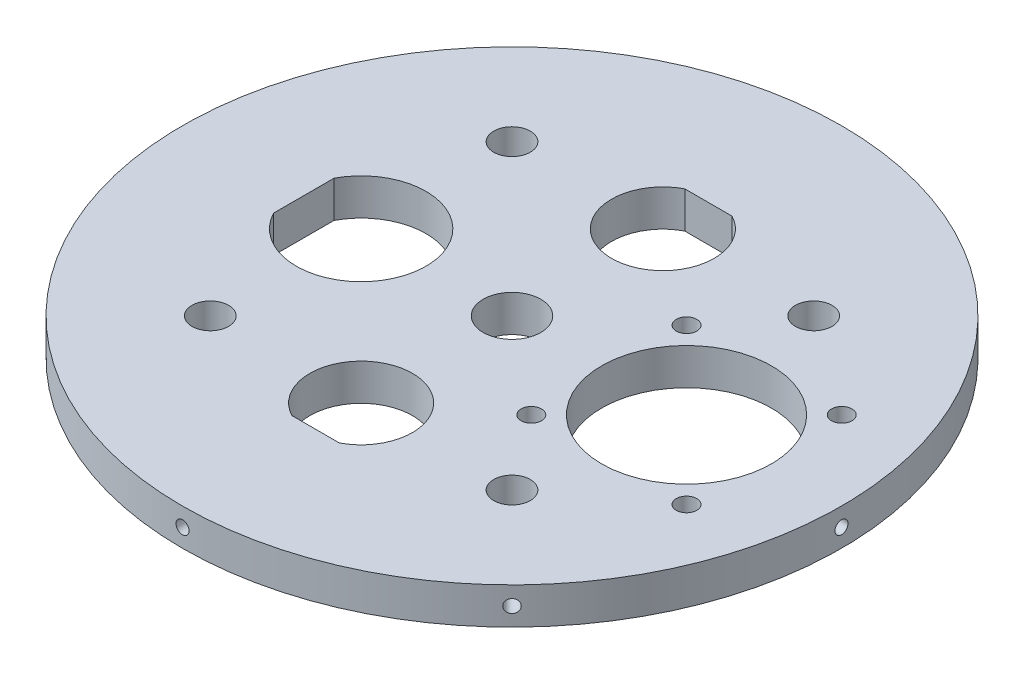
from build123d import *

# Parameters (mm, degrees)
SKETCH2_R           = 57.15
BOSS_EXTRUDE1_DEPTH = 6.35
CUT_EXTRUDE1_REACH  = 83.071
SKETCH6_R           = 3.175
SKETCH7_R           = 14.732
SKETCH7_R_2         = 1.778
CUT_EXTRUDE2_DEPTH  = 82.071372876
SKETCH8_R           = 5
CUT_EXTRUDE3_DEPTH  = 82.071372876
CIRPATTERN1_COUNT   = 8


with BuildPart() as part:
    # Sketch2 → Boss-Extrude1 (new body)
    with BuildSketch(Plane(origin=(0, 0, 0), x_dir=(1, 0, 0), z_dir=(0, 1, 0))):
        Circle(SKETCH2_R)
    extrude(amount=BOSS_EXTRUDE1_DEPTH)

    # Sketch6 → Cut-Extrude1 (cut, up to next)
    with BuildSketch(Plane(origin=(0, 6.35, 0), x_dir=(1, 0, 0), z_dir=(0, 1, 0)), mode=Mode.PRIVATE) as cut_extrude1_sk1:
        with Locations((-26.1629, -26.1629)):
            Circle(SKETCH6_R)
    cut_extrude1_tool1 = extrude(cut_extrude1_sk1.sketch, amount=-CUT_EXTRUDE1_REACH, mode=Mode.PRIVATE) & part.part
    # Sketch6 → Cut-Extrude1 (cut, up to next)
    with BuildSketch(Plane(origin=(0, 6.35, 0), x_dir=(1, 0, 0), z_dir=(0, 1, 0)), mode=Mode.PRIVATE) as cut_extrude1_sk2:
        with Locations((26.1629, -26.1629)):
            Circle(SKETCH6_R)
    cut_extrude1_tool2 = extrude(cut_extrude1_sk2.sketch, amount=-CUT_EXTRUDE1_REACH, mode=Mode.PRIVATE) & part.part
    # Sketch6 → Cut-Extrude1 (cut, up to next)
    with BuildSketch(Plane(origin=(0, 6.35, 0), x_dir=(1, 0, 0), z_dir=(0, 1, 0)), mode=Mode.PRIVATE) as cut_extrude1_sk3:
        with Locations((-26.1629, 26.163103615)):
            Circle(SKETCH6_R)
    cut_extrude1_tool3 = extrude(cut_extrude1_sk3.sketch, amount=-CUT_EXTRUDE1_REACH, mode=Mode.PRIVATE) & part.part
    # Sketch6 → Cut-Extrude1 (cut, up to next)
    with BuildSketch(Plane(origin=(0, 6.35, 0), x_dir=(1, 0, 0), z_dir=(0, 1, 0)), mode=Mode.PRIVATE) as cut_extrude1_sk4:
        with Locations((26.1629, 26.163103615)):
            Circle(SKETCH6_R)
    cut_extrude1_tool4 = extrude(cut_extrude1_sk4.sketch, amount=-CUT_EXTRUDE1_REACH, mode=Mode.PRIVATE) & part.part
    add(cut_extrude1_tool1.solids().sort_by_distance((-26.1629, 6.35, 26.1629))[0], mode=Mode.SUBTRACT)
    add(cut_extrude1_tool2.solids().sort_by_distance((26.1629, 6.35, 26.1629))[0], mode=Mode.SUBTRACT)
    add(cut_extrude1_tool3.solids().sort_by_distance((-26.1629, 6.35, -26.163104))[0], mode=Mode.SUBTRACT)
    add(cut_extrude1_tool4.solids().sort_by_distance((26.1629, 6.35, -26.163104))[0], mode=Mode.SUBTRACT)

    # Sketch7 → Cut-Extrude2 (cut, through all)
    with BuildSketch(Plane(origin=(0, 6.35, 0), x_dir=(1, 0, 0), z_dir=(0, 1, 0))):
        with Locations((30, 0.269903496)):
            Circle(SKETCH7_R)
        with Locations((16.54, -13.194096504)):
            Circle(SKETCH7_R_2)
        with Locations((16.54, 13.729903496)):
            Circle(SKETCH7_R_2)
        with Locations((43.46, 13.729903496)):
            Circle(SKETCH7_R_2)
        with Locations((43.46, -13.194096504)):
            Circle(SKETCH7_R_2)
    extrude(amount=-CUT_EXTRUDE2_DEPTH, mode=Mode.SUBTRACT)

    # Sketch8 → Cut-Extrude3 (cut, through all)
    with BuildSketch(Plane(origin=(0, 6.35, 0), x_dir=(1, 0, 0), z_dir=(0, 1, 0))):
        Circle(SKETCH8_R)
        with BuildLine():
            Line((4.098780306, 34.063103615), (-4.098780306, 34.063103615))
            ThreePointArc((-4.098780306, 34.063103615), (0, 17.263103615), (4.098780306, 34.063103615))
        make_face()
        with BuildLine():
            Line((4.098780306, -34.0629), (-4.098780306, -34.0629))
            ThreePointArc((-4.098780306, -34.0629), (0, -17.2629), (4.098780306, -34.0629))
        make_face()
        with BuildLine():
            Line((-36.1129, 5.249761899), (-36.1129, -5.249761899))
            ThreePointArc((-36.1129, -5.249761899), (-14.9129, 0), (-36.1129, 5.249761899))
        make_face()
    extrude(amount=-CUT_EXTRUDE3_DEPTH, mode=Mode.SUBTRACT)

    # Sketch16 → #4-40 Tapped Hole2 (revolve, cut)
    with BuildSketch(Plane(origin=(0, 3.175, -57.15), x_dir=(0, 1, 0), z_dir=(1, 0, 0))):
        Polygon((0, 0), (0, 10.679152758), (1.1303, 10), (1.1303, 0), align=None)
    f_4_40_tapped_hole2 = revolve(axis=Axis((0, 3.175, -63.5), (0, 0, 1)), mode=Mode.SUBTRACT)

    # CirPattern1: #4-40 Tapped Hole2 ×8 about axis
    cirpattern1_axis = Axis((0, 0, 0), (0, 1, 0))
    for i in range(1, CIRPATTERN1_COUNT):
        add(f_4_40_tapped_hole2.rotate(cirpattern1_axis, i * 360 / CIRPATTERN1_COUNT), mode=Mode.SUBTRACT)


solid = part.part
